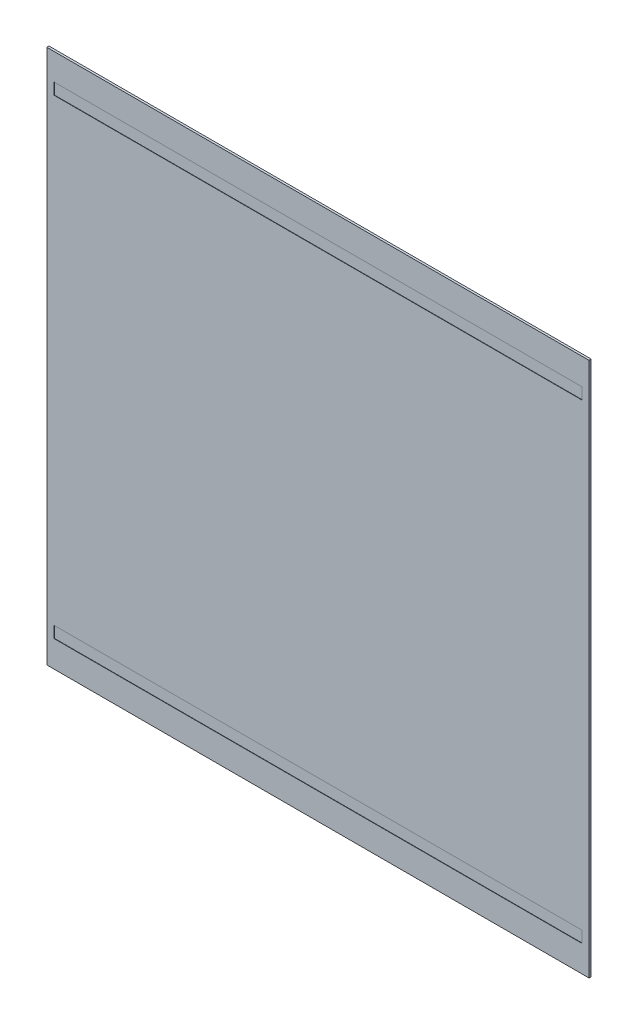
from build123d import *

# Parameters (mm, degrees)
SKETCH1_W          = 75
SKETCH1_H          = 74
EXTRUDE1_DEPTH     = 0.3
SKETCH2_W          = 73.025
SKETCH2_H          = 1.5875
CUT_EXTRUDE1_DEPTH = 0.05


with BuildPart() as part:
    # Sketch1 → Extrude1 (new body)
    with BuildSketch(Plane.XY):
        Rectangle(SKETCH1_W, SKETCH1_H)
    extrude(amount=EXTRUDE1_DEPTH)

    # Sketch2 → Cut-Extrude1 (cut)
    with BuildSketch(Plane.XY.offset(0.3)):
        with Locations((0, 32.54375)):
            Rectangle(SKETCH2_W, SKETCH2_H)
        with Locations((0, -32.54375)):
            Rectangle(SKETCH2_W, SKETCH2_H)
    extrude(amount=-CUT_EXTRUDE1_DEPTH, mode=Mode.SUBTRACT)


solid = part.part
